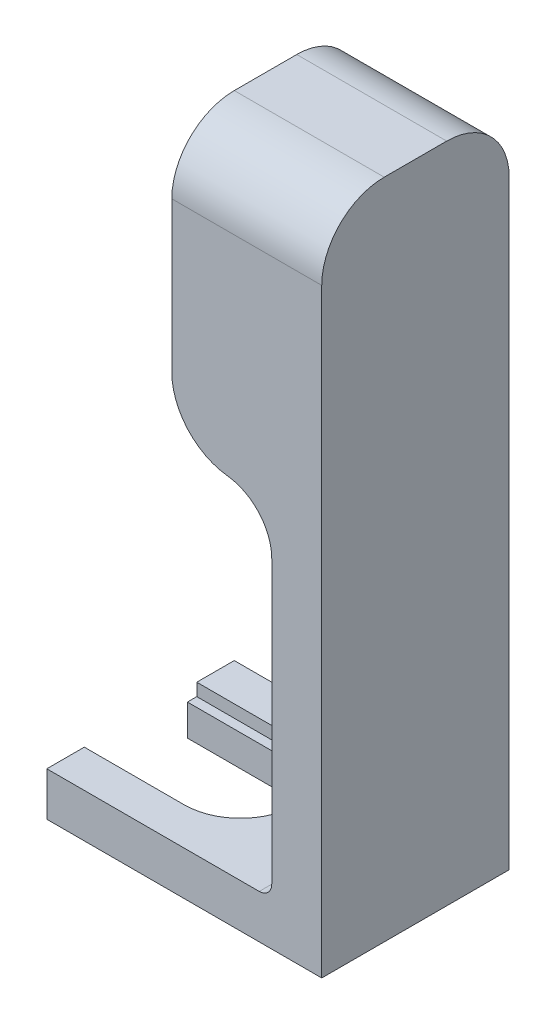
from build123d import *

# Parameters (mm, degrees)
BOSS_EXTRUDE1_DEPTH    = 15
CUT_EXTRUDE1_OUTLINE_R = 3.25
CUT_EXTRUDE1_DEPTH     = 10
CUT_EXTRUDE2_DEPTH     = 1
CUT_EXTRUDE3_REACH     = 56.03
SKETCH5_W              = 8
SKETCH5_H              = 7.5
CUT_EXTRUDE4_DEPTH     = 2.5
FILLET1_R              = 5
FILLET2_R              = 4
FILLET4_R              = 5
FILLET5_R              = 1


# Read off the part's stored shape, not the designer's step: Cut-Extrude1
with BuildPart() as part:
    # Sketch1 → Boss-Extrude1 (new body)
    with BuildSketch(Plane.XY):
        Polygon((0, -8), (0, -30), (8, -30), (8, -57.5), (-10, -57.5), (-10, -61), (12, -61), (12, -8), align=None)
    extrude(amount=BOSS_EXTRUDE1_DEPTH)

    # Cut-Extrude1 outline → Cut-Extrude1 (cut)
    with BuildSketch(Plane.YZ):
        with Locations((-16.5, 7.5)):
            Circle(CUT_EXTRUDE1_OUTLINE_R)
    extrude(amount=CUT_EXTRUDE1_DEPTH, mode=Mode.SUBTRACT)

    # Sketch4 → Cut-Extrude2 (cut)
    with BuildSketch(Plane(origin=(0, -57.5, 0), x_dir=(1, 0, 0), z_dir=(0, 1, 0))):
        with BuildLine():
            Line((-2, -3), (-10, -3))
            Line((-10, -3), (-10, -12))
            Line((-10, -12), (-2, -12))
            ThreePointArc((-2, -12), (2.5, -7.5), (-2, -3))
        make_face()
    extrude(amount=-CUT_EXTRUDE2_DEPTH, mode=Mode.SUBTRACT)

    # Sketch5 → Cut-Extrude3 (cut, up to next)
    with BuildSketch(Plane(origin=(0, -58.5, 0), x_dir=(1, 0, 0), z_dir=(0, 1, 0)), mode=Mode.PRIVATE) as cut_extrude3_sk1:
        with BuildLine():
            ThreePointArc((-2, -11.25), (1.75, -7.5), (-2, -3.75))
            Line((-2, -3.75), (-2, -11.25))
        make_face()
    cut_extrude3_tool1 = extrude(cut_extrude3_sk1.sketch, amount=-CUT_EXTRUDE3_REACH, mode=Mode.PRIVATE) & part.part
    # Sketch5 → Cut-Extrude3 (cut, up to next)
    with BuildSketch(Plane(origin=(0, -58.5, 0), x_dir=(1, 0, 0), z_dir=(0, 1, 0)), mode=Mode.PRIVATE) as cut_extrude3_sk2:
        with Locations((-6, -7.5)):
            Rectangle(SKETCH5_W, SKETCH5_H)
    cut_extrude3_tool2 = extrude(cut_extrude3_sk2.sketch, amount=-CUT_EXTRUDE3_REACH, mode=Mode.PRIVATE) & part.part
    add(cut_extrude3_tool1.solids().sort_by_distance((-0.408451, -58.5, 7.5))[0], mode=Mode.SUBTRACT)
    add(cut_extrude3_tool2.solids().sort_by_distance((-6, -58.5, 7.5))[0], mode=Mode.SUBTRACT)

    # Sketch6 → Cut-Extrude4 (cut)
    with BuildSketch(Plane(origin=(0, -57.5, 0), x_dir=(1, 0, 0), z_dir=(0, 1, 0))):
        with BuildLine():
            Line((5.25, -7.5), (6.25, -7.5))
            ThreePointArc((6.25, -7.5), (6.215550668, -6.74685511), (6.11249037, -6))
            Line((6.11249037, -6), (5.25, -6))
            Line((5.25, -6), (5.25, -7.5))
        make_face()
        with BuildLine():
            ThreePointArc((6.11249037, -9), (6.215550668, -8.25314489), (6.25, -7.5))
            Line((6.25, -7.5), (5.25, -7.5))
            Line((5.25, -7.5), (5.25, -9))
            Line((5.25, -9), (6.11249037, -9))
        make_face()
    extrude(amount=-CUT_EXTRUDE4_DEPTH, mode=Mode.SUBTRACT)

    # Fillet1
    fillet1_edges = [part.edges().sort_by_distance(p)[0] for p in [
        (0, -30, 7.5),
    ]]
    fillet(fillet1_edges, radius=FILLET1_R)

    # Fillet2
    fillet2_edges = [part.edges().sort_by_distance(p)[0] for p in [
        (8, -30, 7.5),
    ]]
    fillet(fillet2_edges, radius=FILLET2_R)

    # Fillet4
    fillet4_edges = [part.edges().sort_by_distance(p)[0] for p in [
        (6, -8, 0),
        (6, -8, 15),
    ]]
    fillet(fillet4_edges, radius=FILLET4_R)

    # Fillet5
    fillet5_edges = [part.edges().sort_by_distance(p)[0] for p in [
        (8, -57.5, 7.5),
    ]]
    fillet(fillet5_edges, radius=FILLET5_R)


solid = part.part
